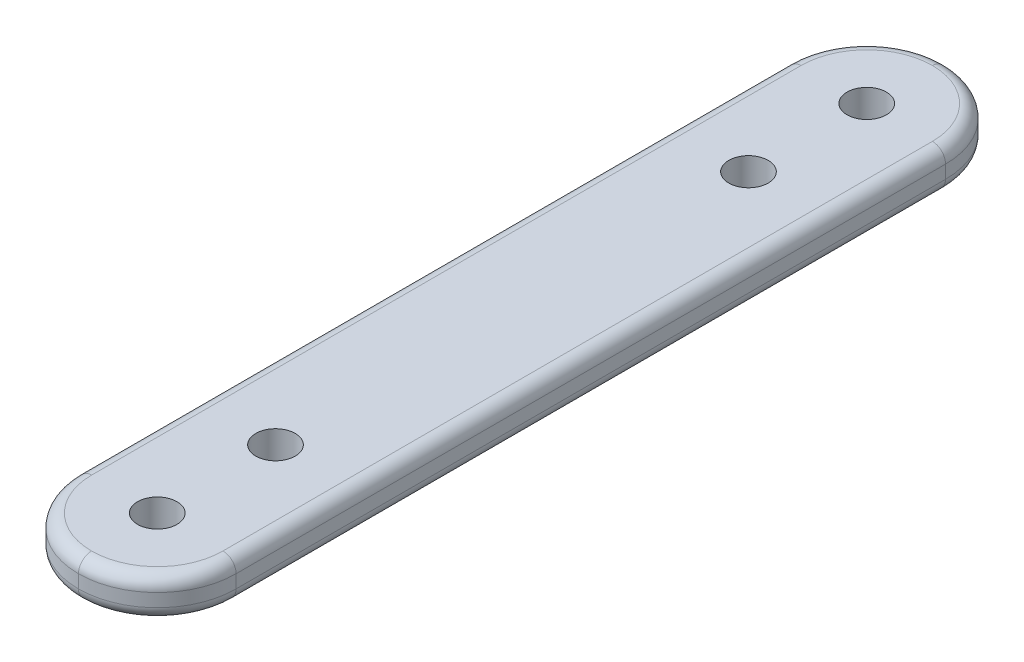
from build123d import *

# Parameters (mm, degrees)
SKETCH1_W           = 25.4
SKETCH1_H           = 139.7
SKETCH1_R           = 3.175
BOSS_EXTRUDE1_DEPTH = 6.35
FILLET2_R           = 12.7
FILLET3_R           = 2.116666667


with BuildPart() as part:
    # Sketch1 → Boss-Extrude1 (new body)
    with BuildSketch(Plane(origin=(0, 0, 0), x_dir=(1, 0, 0), z_dir=(0, 1, 0))):
        Rectangle(SKETCH1_W, SKETCH1_H)
        with Locations(Location((0, -57.15, 0), (0, 0, 270))):
            Circle(SKETCH1_R, mode=Mode.SUBTRACT)
        with Locations(Location((0, 38.1, 0), (0, 0, 270))):
            Circle(SKETCH1_R, mode=Mode.SUBTRACT)
        with Locations(Location((0, 57.15, 0), (0, 0, 270))):
            Circle(SKETCH1_R, mode=Mode.SUBTRACT)
        with Locations(Location((0, -38.1, 0), (0, 0, 270))):
            Circle(SKETCH1_R, mode=Mode.SUBTRACT)
    extrude(amount=BOSS_EXTRUDE1_DEPTH)

    # Fillet2
    fillet2_edges = [part.edges().sort_by_distance(p)[0] for p in [
        (-12.7, 3.175, -69.85),
        (12.7, 3.175, -69.85),
        (-12.7, 3.175, 69.85),
        (12.7, 3.175, 69.85),
    ]]
    fillet(fillet2_edges, radius=FILLET2_R - 0.0001)  # a hair under: the kernel refuses the full size

    # Fillet3
    fillet3_edges = [part.edges().sort_by_distance(p)[0] for p in [
        (-12.7, 0, 0),
        (-12.7, 6.35, 0),
        (12.7, 0, 0),
        (8.98028541, 0, 66.13028541),
        (-8.98028541, 0, 66.13028541),
        (8.98028541, 0, -66.13028541),
        (-8.98028541, 0, -66.13028541),
        (12.7, 6.35, 0),
        (8.98028541, 6.35, 66.13028541),
        (-8.98028541, 6.35, 66.13028541),
        (8.98028541, 6.35, -66.13028541),
        (-8.98028541, 6.35, -66.13028541),
    ]]
    fillet(fillet3_edges, radius=FILLET3_R)


solid = part.part
